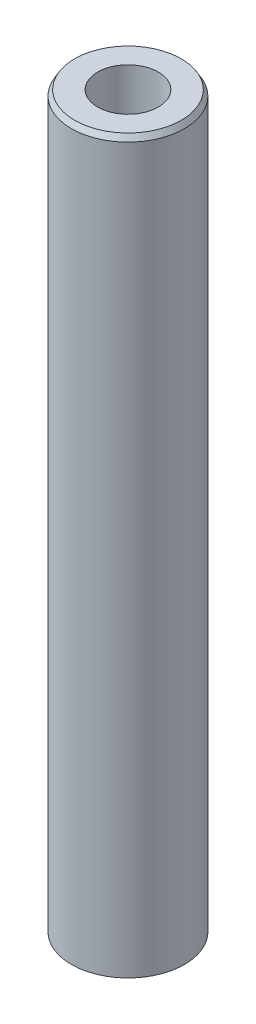
from build123d import *
from OCP.BRepFilletAPI import BRepFilletAPI_MakeChamfer

# Parameters (mm, degrees)
SKETCH1_R           = 27.5
BOSS_EXTRUDE1_DEPTH = 356.323004634
SKETCH2_R           = 14.751643424
CUT_EXTRUDE1_DEPTH  = 359.439093336
CHAMFER1_SIZE       = 2.729570884
CHAMFER1_SIZE2      = 1.575918485


with BuildPart() as part:
    # Sketch1 → Boss-Extrude1 (new body)
    with BuildSketch(Plane(origin=(0, 0, 0), x_dir=(1, 0, 0), z_dir=(0, 1, 0))):
        Circle(SKETCH1_R)
    extrude(amount=BOSS_EXTRUDE1_DEPTH)

    # Sketch2 → Cut-Extrude1 (cut, through all)
    with BuildSketch(Plane(origin=(0, 0, 0), x_dir=(1, 0, 0), z_dir=(0, 1, 0))):
        Circle(SKETCH2_R)
    extrude(amount=CUT_EXTRUDE1_DEPTH, mode=Mode.SUBTRACT)

    # Chamfer1: one chamfer whose edges measure the first distance from different faces: ONE call of the kernel's chamfer builder (chamfer() names one face for all edges)
    chamfer1_edges_1 = [part.edges().sort_by_distance(p)[0] for p in [
        (-27.5, 356.323004634, 0),
    ]]
    chamfer1_side_1 = [part.faces().sort_by_distance(p)[0] for p in [
        (-27.5, 178.161502317, 0),
    ]]
    chamfer1_edges_2 = [part.edges().sort_by_distance(p)[0] for p in [
        (-27.5, 0, 0),
    ]]
    chamfer1_side_2 = [part.faces().sort_by_distance(p)[0] for p in [
        (-26.722182541, 0, 0),
    ]]
    chamfer1 = BRepFilletAPI_MakeChamfer(part.part.solid().wrapped)
    for e in chamfer1_edges_1:
        chamfer1.Add(CHAMFER1_SIZE, CHAMFER1_SIZE2, e.wrapped, chamfer1_side_1[0].wrapped)  # the first distance lies on this face
    for e in chamfer1_edges_2:
        chamfer1.Add(CHAMFER1_SIZE, CHAMFER1_SIZE2, e.wrapped, chamfer1_side_2[0].wrapped)  # the first distance lies on this face
    add(Compound.cast(chamfer1.Shape()), mode=Mode.REPLACE)


solid = part.part
